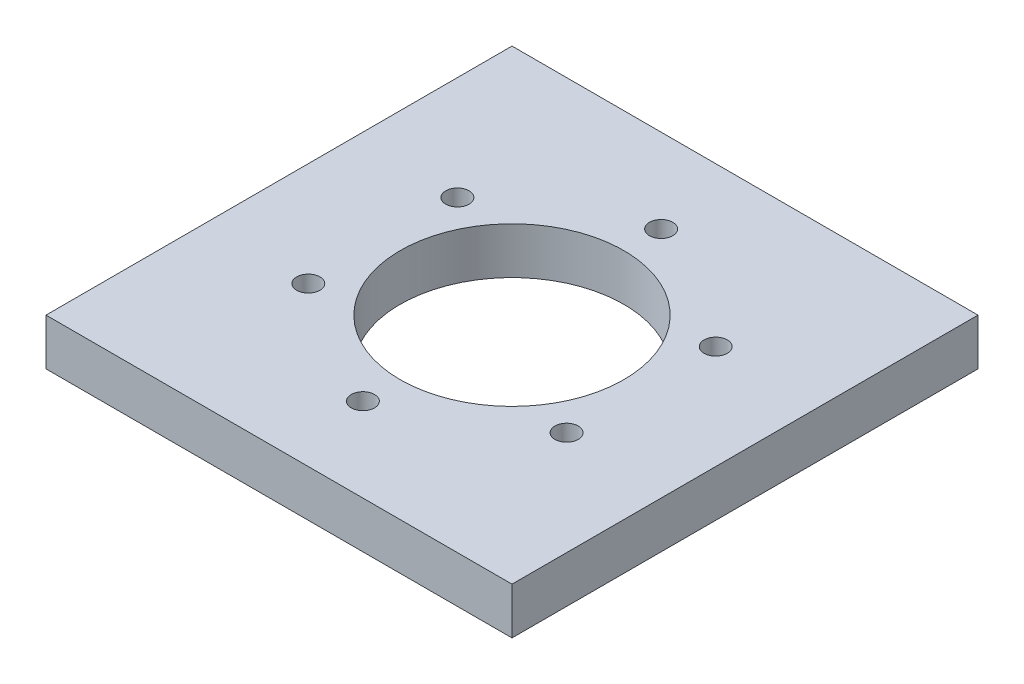
from build123d import *

# Parameters (mm, degrees)
SKETCH2_W           = 50
SKETCH2_H           = 50
SKETCH2_R           = 12
BOSS_EXTRUDE1_DEPTH = 5
SKETCH5_R           = 1.25
CUT_EXTRUDE1_DEPTH  = 6


with BuildPart() as part:
    # Sketch2 → Boss-Extrude1 (new body)
    with BuildSketch(Plane(origin=(0, 0, 0), x_dir=(1, 0, 0), z_dir=(0, 1, 0))):
        with Locations((6.306729133, -0.854355406)):
            Rectangle(SKETCH2_W, SKETCH2_H)
        with Locations((6.306729133, -0.854355406)):
            Circle(SKETCH2_R, mode=Mode.SUBTRACT)
    extrude(amount=BOSS_EXTRUDE1_DEPTH)

    # Sketch5 → Cut-Extrude1 (cut)
    with BuildSketch(Plane(origin=(0, 5, 0), x_dir=(1, 0, 0), z_dir=(0, 1, 0))):
        with Locations((6.306729133, 15.145644594)):
            Circle(SKETCH5_R)
        with Locations((20.163135594, 7.145644594)):
            Circle(SKETCH5_R)
        with Locations((20.163135594, -8.854355406)):
            Circle(SKETCH5_R)
        with Locations((6.306729133, -16.854355406)):
            Circle(SKETCH5_R)
        with Locations((-7.549677327, -8.854355406)):
            Circle(SKETCH5_R)
        with Locations((-7.549677327, 7.145644594)):
            Circle(SKETCH5_R)
    extrude(amount=-CUT_EXTRUDE1_DEPTH, mode=Mode.SUBTRACT)


solid = part.part
